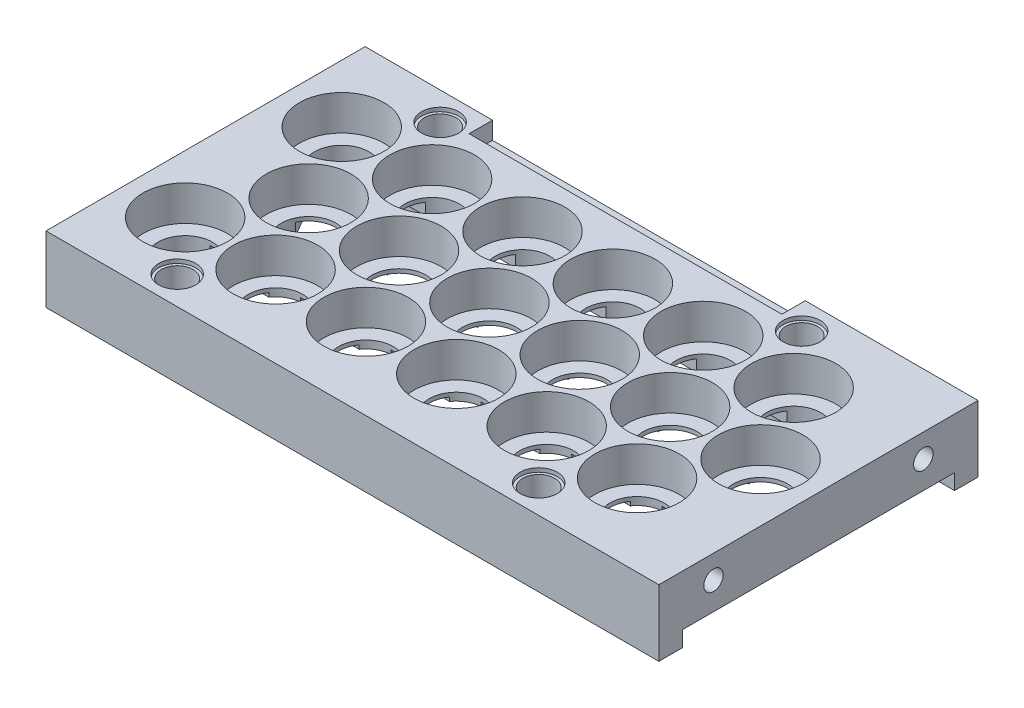
from build123d import *
from build123d.topology import SkipClean

# Parameters (mm, degrees)
SKETCH1_W            = 156.975
SKETCH1_H            = 81.746976195
SKETCH1_R            = 10.825
BOSS_EXTRUDE2_DEPTH  = 11
SKETCH1_3_R          = 10.825
SKETCH1_3_R_2        = 7
BOSS_EXTRUDE3_DEPTH  = 2
CUT_EXTRUDE1_DEPTH   = 1
CUT_EXTRUDE3_REACH   = 157.046
SKETCH9_R            = 4.0767
SKETCH10_R           = 4.7625
CUT_EXTRUDE4_DEPTH   = 1
SKETCH13_R           = 6.5
BOSS_EXTRUDE7_DEPTH  = 6
BOSS_EXTRUDE9_START  = 2
BOSS_EXTRUDE9_DEPTH  = 2
BOSS_EXTRUDE10_DEPTH = 2
SKETCH17_R           = 2
CUT_EXTRUDE5_DEPTH   = 4
SKETCH18_W           = 80.1
SKETCH18_H           = 4.475
CUT_EXTRUDE6_DEPTH   = 6
SKETCH19_R           = 2
CUT_EXTRUDE7_DEPTH   = 5
SKETCH20_R           = 2.5
CUT_EXTRUDE8_DEPTH   = 10


with BuildPart() as part:
    # Sketch1 → Boss-Extrude2 (new body)
    with BuildSketch(Plane(origin=(0, 0, 0), x_dir=(1, 0, 0), z_dir=(0, 1, 0))):
        with Locations((63.6625, -20.048488098)):
            Rectangle(SKETCH1_W, SKETCH1_H)
        with Locations((0, -40.096976195)):
            Circle(SKETCH1_R, mode=Mode.SUBTRACT)
        with Locations((23.15, -40.096976195)):
            Circle(SKETCH1_R, mode=Mode.SUBTRACT)
        with Locations((46.3, -40.096976195)):
            Circle(SKETCH1_R, mode=Mode.SUBTRACT)
        with Locations((69.45, -40.096976195)):
            Circle(SKETCH1_R, mode=Mode.SUBTRACT)
        with Locations((92.6, -40.096976195)):
            Circle(SKETCH1_R, mode=Mode.SUBTRACT)
        with Locations((115.75, -40.096976195)):
            Circle(SKETCH1_R, mode=Mode.SUBTRACT)
        with Locations((11.575, -20.048488098)):
            Circle(SKETCH1_R, mode=Mode.SUBTRACT)
        Circle(SKETCH1_R, mode=Mode.SUBTRACT)
        with Locations((23.15, 0)):
            Circle(SKETCH1_R, mode=Mode.SUBTRACT)
        with Locations((34.725, -20.048488098)):
            Circle(SKETCH1_R, mode=Mode.SUBTRACT)
        with Locations((57.875, -20.048488098)):
            Circle(SKETCH1_R, mode=Mode.SUBTRACT)
        with Locations((46.3, 0)):
            Circle(SKETCH1_R, mode=Mode.SUBTRACT)
        with Locations((81.025, -20.048488098)):
            Circle(SKETCH1_R, mode=Mode.SUBTRACT)
        with Locations((69.45, 0)):
            Circle(SKETCH1_R, mode=Mode.SUBTRACT)
        with Locations((92.6, 0)):
            Circle(SKETCH1_R, mode=Mode.SUBTRACT)
        with Locations((104.175, -20.048488098)):
            Circle(SKETCH1_R, mode=Mode.SUBTRACT)
        with Locations((127.325, -20.048488098)):
            Circle(SKETCH1_R, mode=Mode.SUBTRACT)
        with Locations((115.75, 0)):
            Circle(SKETCH1_R, mode=Mode.SUBTRACT)
    extrude(amount=BOSS_EXTRUDE2_DEPTH)

    # Sketch1<3> → Boss-Extrude3 (add)
    # profile 1 of 18: a face of its own
    with BuildSketch(Plane(origin=(0, 0, 0), x_dir=(1, 0, 0), z_dir=(0, 1, 0))):
        Circle(SKETCH1_3_R)
        Circle(SKETCH1_3_R_2, mode=Mode.SUBTRACT)
    # profile 2 of 18: a face of its own
    with BuildSketch(Plane(origin=(0, 0, 0), x_dir=(1, 0, 0), z_dir=(0, 1, 0))):
        with Locations((11.575, -20.048488098)):
            Circle(SKETCH1_3_R)
        with Locations((11.575, -20.048488098)):
            Circle(SKETCH1_3_R_2, mode=Mode.SUBTRACT)
    # profile 3 of 18: a face of its own
    with BuildSketch(Plane(origin=(0, 0, 0), x_dir=(1, 0, 0), z_dir=(0, 1, 0))):
        with Locations((0, -40.096976195)):
            Circle(SKETCH1_3_R)
        with Locations((0, -40.096976195)):
            Circle(SKETCH1_3_R_2, mode=Mode.SUBTRACT)
    # profile 4 of 18: a face of its own
    with BuildSketch(Plane(origin=(0, 0, 0), x_dir=(1, 0, 0), z_dir=(0, 1, 0))):
        with Locations((23.15, 0)):
            Circle(SKETCH1_3_R)
        with Locations((23.15, 0)):
            Circle(SKETCH1_3_R_2, mode=Mode.SUBTRACT)
    # profile 5 of 18: a face of its own
    with BuildSketch(Plane(origin=(0, 0, 0), x_dir=(1, 0, 0), z_dir=(0, 1, 0))):
        with Locations((34.725, -20.048488098)):
            Circle(SKETCH1_3_R)
        with Locations((34.725, -20.048488098)):
            Circle(SKETCH1_3_R_2, mode=Mode.SUBTRACT)
    # profile 6 of 18: a face of its own
    with BuildSketch(Plane(origin=(0, 0, 0), x_dir=(1, 0, 0), z_dir=(0, 1, 0))):
        with Locations((23.15, -40.096976195)):
            Circle(SKETCH1_3_R)
        with Locations((23.15, -40.096976195)):
            Circle(SKETCH1_3_R_2, mode=Mode.SUBTRACT)
    # profile 7 of 18: a face of its own
    with BuildSketch(Plane(origin=(0, 0, 0), x_dir=(1, 0, 0), z_dir=(0, 1, 0))):
        with Locations((46.3, 0)):
            Circle(SKETCH1_3_R)
        with Locations((46.3, 0)):
            Circle(SKETCH1_3_R_2, mode=Mode.SUBTRACT)
    # profile 8 of 18: a face of its own
    with BuildSketch(Plane(origin=(0, 0, 0), x_dir=(1, 0, 0), z_dir=(0, 1, 0))):
        with Locations((57.875, -20.048488098)):
            Circle(SKETCH1_3_R)
        with Locations((57.875, -20.048488098)):
            Circle(SKETCH1_3_R_2, mode=Mode.SUBTRACT)
    # profile 9 of 18: a face of its own
    with BuildSketch(Plane(origin=(0, 0, 0), x_dir=(1, 0, 0), z_dir=(0, 1, 0))):
        with Locations((46.3, -40.096976195)):
            Circle(SKETCH1_3_R)
        with Locations((46.3, -40.096976195)):
            Circle(SKETCH1_3_R_2, mode=Mode.SUBTRACT)
    # profile 10 of 18: a face of its own
    with BuildSketch(Plane(origin=(0, 0, 0), x_dir=(1, 0, 0), z_dir=(0, 1, 0))):
        with Locations((69.45, 0)):
            Circle(SKETCH1_3_R)
        with Locations((69.45, 0)):
            Circle(SKETCH1_3_R_2, mode=Mode.SUBTRACT)
    # profile 11 of 18: a face of its own
    with BuildSketch(Plane(origin=(0, 0, 0), x_dir=(1, 0, 0), z_dir=(0, 1, 0))):
        with Locations((81.025, -20.048488098)):
            Circle(SKETCH1_3_R)
        with Locations((81.025, -20.048488098)):
            Circle(SKETCH1_3_R_2, mode=Mode.SUBTRACT)
    # profile 12 of 18: a face of its own
    with BuildSketch(Plane(origin=(0, 0, 0), x_dir=(1, 0, 0), z_dir=(0, 1, 0))):
        with Locations((69.45, -40.096976195)):
            Circle(SKETCH1_3_R)
        with Locations((69.45, -40.096976195)):
            Circle(SKETCH1_3_R_2, mode=Mode.SUBTRACT)
    # profile 13 of 18: a face of its own
    with BuildSketch(Plane(origin=(0, 0, 0), x_dir=(1, 0, 0), z_dir=(0, 1, 0))):
        with Locations((92.6, 0)):
            Circle(SKETCH1_3_R)
        with Locations((92.6, 0)):
            Circle(SKETCH1_3_R_2, mode=Mode.SUBTRACT)
    # profile 14 of 18: a face of its own
    with BuildSketch(Plane(origin=(0, 0, 0), x_dir=(1, 0, 0), z_dir=(0, 1, 0))):
        with Locations((104.175, -20.048488098)):
            Circle(SKETCH1_3_R)
        with Locations((104.175, -20.048488098)):
            Circle(SKETCH1_3_R_2, mode=Mode.SUBTRACT)
    # profile 15 of 18: a face of its own
    with BuildSketch(Plane(origin=(0, 0, 0), x_dir=(1, 0, 0), z_dir=(0, 1, 0))):
        with Locations((92.6, -40.096976195)):
            Circle(SKETCH1_3_R)
        with Locations((92.6, -40.096976195)):
            Circle(SKETCH1_3_R_2, mode=Mode.SUBTRACT)
    # profile 16 of 18: a face of its own
    with BuildSketch(Plane(origin=(0, 0, 0), x_dir=(1, 0, 0), z_dir=(0, 1, 0))):
        with Locations((115.75, 0)):
            Circle(SKETCH1_3_R)
        with Locations((115.75, 0)):
            Circle(SKETCH1_3_R_2, mode=Mode.SUBTRACT)
    # profile 17 of 18: a face of its own
    with BuildSketch(Plane(origin=(0, 0, 0), x_dir=(1, 0, 0), z_dir=(0, 1, 0))):
        with Locations((127.325, -20.048488098)):
            Circle(SKETCH1_3_R)
        with Locations((127.325, -20.048488098)):
            Circle(SKETCH1_3_R_2, mode=Mode.SUBTRACT)
    # profile 18 of 18: a face of its own
    with BuildSketch(Plane(origin=(0, 0, 0), x_dir=(1, 0, 0), z_dir=(0, 1, 0))):
        with Locations((115.75, -40.096976195)):
            Circle(SKETCH1_3_R)
        with Locations((115.75, -40.096976195)):
            Circle(SKETCH1_3_R_2, mode=Mode.SUBTRACT)
    extrude(amount=BOSS_EXTRUDE3_DEPTH)

    # Sketch2 → Cut-Extrude1 (cut)
    with BuildSketch(Plane.XZ):
        with BuildLine():
            Line((-0.591820292, 33.12203901), (5.238617062, 23.023425283))
            ThreePointArc((5.238617062, 23.023425283), (8.075, 26.110665924), (12.166820292, 27.023425283))
            Line((12.166820292, 27.023425283), (6.92820323, 36.096976195))
            Line((6.92820323, 36.096976195), (17.405437353, 36.096976195))
            ThreePointArc((17.405437353, 36.096976195), (16.15, 40.096976195), (17.405437353, 44.096976195))
            Line((17.405437353, 44.096976195), (5.744562647, 44.096976195))
            ThreePointArc((5.744562647, 44.096976195), (6.062177826, 36.596976195), (-0.591820292, 33.12203901))
        make_face()
        with BuildLine():
            Line((27.79679677, 24.048488098), (17.319562647, 24.048488098))
            ThreePointArc((17.319562647, 24.048488098), (18.575, 20.048488098), (17.319562647, 16.048488098))
            Line((17.319562647, 16.048488098), (27.79679677, 16.048488098))
            Line((27.79679677, 16.048488098), (22.558179708, 6.974937186))
            ThreePointArc((22.558179708, 6.974937186), (26.124937186, 6.336382938), (28.894562647, 4))
            Line((28.894562647, 4), (6.92820323, 4))
            Line((6.92820323, 4), (12.166820292, 13.073550912))
            ThreePointArc((12.166820292, 13.073550912), (8.075, 13.986310271), (5.238617062, 17.073550912))
            Line((5.238617062, 17.073550912), (-0.591820292, 6.974937186))
            ThreePointArc((-0.591820292, 6.974937186), (2.974937186, 6.336382938), (5.744562647, 4))
            Line((5.744562647, 4), (0, 4))
            ThreePointArc((0, 4), (-4, 0), (0, -4))
            Line((0, -4), (115.75, -4))
            ThreePointArc((115.75, -4), (119.75, 0), (115.75, 4))
            Line((115.75, 4), (99.52820323, 4))
            Line((99.52820323, 4), (104.766820292, 13.073550912))
            ThreePointArc((104.766820292, 13.073550912), (97.175, 20.048488098), (104.766820292, 27.023425283))
            Line((104.766820292, 27.023425283), (99.52820323, 36.096976195))
            Line((99.52820323, 36.096976195), (110.005437353, 36.096976195))
            ThreePointArc((110.005437353, 36.096976195), (108.75, 40.096976195), (110.005437353, 44.096976195))
            Line((110.005437353, 44.096976195), (98.344562647, 44.096976195))
            ThreePointArc((98.344562647, 44.096976195), (98.662177826, 36.596976195), (92.008179708, 33.12203901))
            Line((92.008179708, 33.12203901), (97.24679677, 24.048488098))
            Line((97.24679677, 24.048488098), (86.769562647, 24.048488098))
            ThreePointArc((86.769562647, 24.048488098), (88.025, 20.048488098), (86.769562647, 16.048488098))
            Line((86.769562647, 16.048488098), (97.24679677, 16.048488098))
            Line((97.24679677, 16.048488098), (92.008179708, 6.974937186))
            ThreePointArc((92.008179708, 6.974937186), (95.574937186, 6.336382938), (98.344562647, 4))
            Line((98.344562647, 4), (76.37820323, 4))
            Line((76.37820323, 4), (81.616820292, 13.073550912))
            ThreePointArc((81.616820292, 13.073550912), (74.025, 20.048488098), (81.616820292, 27.023425283))
            Line((81.616820292, 27.023425283), (76.37820323, 36.096976195))
            Line((76.37820323, 36.096976195), (86.855437353, 36.096976195))
            ThreePointArc((86.855437353, 36.096976195), (85.6, 40.096976195), (86.855437353, 44.096976195))
            Line((86.855437353, 44.096976195), (75.194562647, 44.096976195))
            ThreePointArc((75.194562647, 44.096976195), (75.512177826, 36.596976195), (68.858179708, 33.12203901))
            Line((68.858179708, 33.12203901), (74.09679677, 24.048488098))
            Line((74.09679677, 24.048488098), (63.619562647, 24.048488098))
            ThreePointArc((63.619562647, 24.048488098), (64.875, 20.048488098), (63.619562647, 16.048488098))
            Line((63.619562647, 16.048488098), (74.09679677, 16.048488098))
            Line((74.09679677, 16.048488098), (68.858179708, 6.974937186))
            ThreePointArc((68.858179708, 6.974937186), (72.424937186, 6.336382938), (75.194562647, 4))
            Line((75.194562647, 4), (53.22820323, 4))
            Line((53.22820323, 4), (58.466820292, 13.073550912))
            ThreePointArc((58.466820292, 13.073550912), (50.875, 20.048488098), (58.466820292, 27.023425283))
            Line((58.466820292, 27.023425283), (53.22820323, 36.096976195))
            Line((53.22820323, 36.096976195), (63.705437353, 36.096976195))
            ThreePointArc((63.705437353, 36.096976195), (62.45, 40.096976195), (63.705437353, 44.096976195))
            Line((63.705437353, 44.096976195), (52.044562647, 44.096976195))
            ThreePointArc((52.044562647, 44.096976195), (52.362177826, 36.596976195), (45.708179708, 33.12203901))
            Line((45.708179708, 33.12203901), (50.94679677, 24.048488098))
            Line((50.94679677, 24.048488098), (40.469562647, 24.048488098))
            ThreePointArc((40.469562647, 24.048488098), (41.725, 20.048488098), (40.469562647, 16.048488098))
            Line((40.469562647, 16.048488098), (50.94679677, 16.048488098))
            Line((50.94679677, 16.048488098), (45.708179708, 6.974937186))
            ThreePointArc((45.708179708, 6.974937186), (49.274937186, 6.336382938), (52.044562647, 4))
            Line((52.044562647, 4), (30.07820323, 4))
            Line((30.07820323, 4), (35.316820292, 13.073550912))
            ThreePointArc((35.316820292, 13.073550912), (27.725, 20.048488098), (35.316820292, 27.023425283))
            Line((35.316820292, 27.023425283), (30.07820323, 36.096976195))
            Line((30.07820323, 36.096976195), (40.555437353, 36.096976195))
            ThreePointArc((40.555437353, 36.096976195), (39.3, 40.096976195), (40.555437353, 44.096976195))
            Line((40.555437353, 44.096976195), (28.894562647, 44.096976195))
            ThreePointArc((28.894562647, 44.096976195), (29.212177826, 36.596976195), (22.558179708, 33.12203901))
            Line((22.558179708, 33.12203901), (27.79679677, 24.048488098))
        make_face()
        with BuildLine():
            Line((127.916820292, 27.023425283), (122.086382938, 37.12203901))
            ThreePointArc((122.086382938, 37.12203901), (119.25, 34.034798369), (115.158179708, 33.12203901))
            Line((115.158179708, 33.12203901), (120.39679677, 24.048488098))
            Line((120.39679677, 24.048488098), (109.919562647, 24.048488098))
            ThreePointArc((109.919562647, 24.048488098), (111.175, 20.048488098), (109.919562647, 16.048488098))
            Line((109.919562647, 16.048488098), (120.39679677, 16.048488098))
            Line((120.39679677, 16.048488098), (115.158179708, 6.974937186))
            ThreePointArc((115.158179708, 6.974937186), (119.25, 6.062177826), (122.086382938, 2.974937186))
            Line((122.086382938, 2.974937186), (127.916820292, 13.073550912))
            ThreePointArc((127.916820292, 13.073550912), (120.325, 20.048488098), (127.916820292, 27.023425283))
        make_face()
    extrude(amount=-CUT_EXTRUDE1_DEPTH, mode=Mode.SUBTRACT)

    # Sketch9 → Cut-Extrude3 (cut, up to next)
    with BuildSketch(Plane(origin=(0, 11, 0), x_dir=(1, 0, 0), z_dir=(0, 1, 0)), mode=Mode.PRIVATE) as cut_extrude3_sk1:
        with Locations((11.575, 13.625)):
            Circle(SKETCH9_R)
    cut_extrude3_tool1 = extrude(cut_extrude3_sk1.sketch, amount=-CUT_EXTRUDE3_REACH, mode=Mode.PRIVATE) & part.part
    # Sketch9 → Cut-Extrude3 (cut, up to next)
    with BuildSketch(Plane(origin=(0, 11, 0), x_dir=(1, 0, 0), z_dir=(0, 1, 0)), mode=Mode.PRIVATE) as cut_extrude3_sk2:
        with Locations((11.575, -53.721976195)):
            Circle(SKETCH9_R)
    cut_extrude3_tool2 = extrude(cut_extrude3_sk2.sketch, amount=-CUT_EXTRUDE3_REACH, mode=Mode.PRIVATE) & part.part
    # Sketch9 → Cut-Extrude3 (cut, up to next)
    with BuildSketch(Plane(origin=(0, 11, 0), x_dir=(1, 0, 0), z_dir=(0, 1, 0)), mode=Mode.PRIVATE) as cut_extrude3_sk3:
        with Locations((104.175, -53.721976195)):
            Circle(SKETCH9_R)
    cut_extrude3_tool3 = extrude(cut_extrude3_sk3.sketch, amount=-CUT_EXTRUDE3_REACH, mode=Mode.PRIVATE) & part.part
    # Sketch9 → Cut-Extrude3 (cut, up to next)
    with BuildSketch(Plane(origin=(0, 11, 0), x_dir=(1, 0, 0), z_dir=(0, 1, 0)), mode=Mode.PRIVATE) as cut_extrude3_sk4:
        with Locations((104.175, 13.625)):
            Circle(SKETCH9_R)
    cut_extrude3_tool4 = extrude(cut_extrude3_sk4.sketch, amount=-CUT_EXTRUDE3_REACH, mode=Mode.PRIVATE) & part.part
    add(cut_extrude3_tool1.solids().sort_by_distance((11.575, 11, -13.625))[0], mode=Mode.SUBTRACT)
    add(cut_extrude3_tool2.solids().sort_by_distance((11.575, 11, 53.721976))[0], mode=Mode.SUBTRACT)
    add(cut_extrude3_tool3.solids().sort_by_distance((104.175, 11, 53.721976))[0], mode=Mode.SUBTRACT)
    add(cut_extrude3_tool4.solids().sort_by_distance((104.175, 11, -13.625))[0], mode=Mode.SUBTRACT)

    # Sketch10 → Cut-Extrude4 (cut)
    with BuildSketch(Plane(origin=(0, 11, 0), x_dir=(1, 0, 0), z_dir=(0, 1, 0))):
        with Locations((11.575, 13.625)):
            Circle(SKETCH10_R)
        with Locations((104.175, 13.625)):
            Circle(SKETCH10_R)
        with Locations((104.175, -53.721976195)):
            Circle(SKETCH10_R)
        with Locations((11.575, -53.721976195)):
            Circle(SKETCH10_R)
    extrude(amount=-CUT_EXTRUDE4_DEPTH, mode=Mode.SUBTRACT)

    # Sketch13 → Boss-Extrude7 (add)
    # profile 1 of 2: a face of its own
    with BuildSketch(Plane.XZ):
        with BuildLine():
            ThreePointArc((3.665512027, 54.921976195), (11.575, 45.721976195), (19.484487973, 54.921976195))
            Line((19.484487973, 54.921976195), (96.265512027, 54.921976195))
            ThreePointArc((96.265512027, 54.921976195), (104.175, 45.721976195), (112.084487973, 54.921976195))
            Line((112.084487973, 54.921976195), (142.15, 54.921976195))
            Line((142.15, 54.921976195), (142.15, 60.921976195))
            Line((142.15, 60.921976195), (-14.825, 60.921976195))
            Line((-14.825, 60.921976195), (-14.825, 54.921976195))
            Line((-14.825, 54.921976195), (3.665512027, 54.921976195))
        make_face()
        with Locations((11.575, 53.721976195)):
            Circle(SKETCH13_R, mode=Mode.SUBTRACT)
        with Locations((104.175, 53.721976195)):
            Circle(SKETCH13_R, mode=Mode.SUBTRACT)
    # profile 2 of 2: a face of its own
    with BuildSketch(Plane.XZ):
        with BuildLine():
            Line((-14.825, -14.825), (-14.825, -20.825))
            Line((-14.825, -20.825), (142.15, -20.825))
            Line((142.15, -20.825), (142.15, -14.825))
            Line((142.15, -14.825), (112.084487973, -14.825))
            ThreePointArc((112.084487973, -14.825), (104.175, -5.625), (96.265512027, -14.825))
            Line((96.265512027, -14.825), (19.484487973, -14.825))
            ThreePointArc((19.484487973, -14.825), (11.575, -5.625), (3.665512027, -14.825))
            Line((3.665512027, -14.825), (-14.825, -14.825))
        make_face()
        with Locations((11.575, -13.625)):
            Circle(SKETCH13_R, mode=Mode.SUBTRACT)
        with Locations((104.175, -13.625)):
            Circle(SKETCH13_R, mode=Mode.SUBTRACT)
    extrude(amount=BOSS_EXTRUDE7_DEPTH)

    # Sketch14 → Boss-Extrude9 (add)
    with SkipClean():  # the faces are left unmerged after this step: merging them gives an invalid solid
        with BuildSketch(Plane.XZ.offset(BOSS_EXTRUDE9_START)):
            with BuildLine():
                Line((142.15, 54.921976195), (142.15, -14.825))
                Line((142.15, -14.825), (112.084487973, -14.825))
                ThreePointArc((112.084487973, -14.825), (104.175, -5.625), (96.265512027, -14.825))
                Line((96.265512027, -14.825), (19.484487973, -14.825))
                ThreePointArc((19.484487973, -14.825), (11.575, -5.625), (3.665512027, -14.825))
                Line((3.665512027, -14.825), (-14.825, -14.825))
                Line((-14.825, -14.825), (-14.825, 54.921976195))
                Line((-14.825, 54.921976195), (3.665512027, 54.921976195))
                ThreePointArc((3.665512027, 54.921976195), (11.575, 45.721976195), (19.484487973, 54.921976195))
                Line((19.484487973, 54.921976195), (96.265512027, 54.921976195))
                ThreePointArc((96.265512027, 54.921976195), (104.175, 45.721976195), (112.084487973, 54.921976195))
                Line((112.084487973, 54.921976195), (142.15, 54.921976195))
            make_face()
            with BuildLine():
                Line((5.238617062, 17.073550912), (-0.591820292, 6.974937186))
                ThreePointArc((-0.591820292, 6.974937186), (-6.062177826, -3.5), (5.744562647, -4))
                Line((5.744562647, -4), (17.405437353, -4))
                ThreePointArc((17.405437353, -4), (23.15, -7), (28.894562647, -4))
                Line((28.894562647, -4), (40.555437353, -4))
                ThreePointArc((40.555437353, -4), (46.3, -7), (52.044562647, -4))
                Line((52.044562647, -4), (63.705437353, -4))
                ThreePointArc((63.705437353, -4), (69.45, -7), (75.194562647, -4))
                Line((75.194562647, -4), (86.855437353, -4))
                ThreePointArc((86.855437353, -4), (92.6, -7), (98.344562647, -4))
                Line((98.344562647, -4), (110.005437353, -4))
                ThreePointArc((110.005437353, -4), (119.25, -6.062177826), (122.086382938, 2.974937186))
                Line((122.086382938, 2.974937186), (127.916820292, 13.073550912))
                ThreePointArc((127.916820292, 13.073550912), (134.325, 20.048488098), (127.916820292, 27.023425283))
                Line((127.916820292, 27.023425283), (122.086382938, 37.12203901))
                ThreePointArc((122.086382938, 37.12203901), (119.25, 46.159154022), (110.005437353, 44.096976195))
                Line((110.005437353, 44.096976195), (98.344562647, 44.096976195))
                ThreePointArc((98.344562647, 44.096976195), (92.6, 47.096976195), (86.855437353, 44.096976195))
                Line((86.855437353, 44.096976195), (75.194562647, 44.096976195))
                ThreePointArc((75.194562647, 44.096976195), (69.45, 47.096976195), (63.705437353, 44.096976195))
                Line((63.705437353, 44.096976195), (52.044562647, 44.096976195))
                ThreePointArc((52.044562647, 44.096976195), (46.3, 47.096976195), (40.555437353, 44.096976195))
                Line((40.555437353, 44.096976195), (28.894562647, 44.096976195))
                ThreePointArc((28.894562647, 44.096976195), (23.15, 47.096976195), (17.405437353, 44.096976195))
                Line((17.405437353, 44.096976195), (5.744562647, 44.096976195))
                ThreePointArc((5.744562647, 44.096976195), (-6.062177826, 43.596976195), (-0.591820292, 33.12203901))
                Line((-0.591820292, 33.12203901), (5.238617062, 23.023425283))
                ThreePointArc((5.238617062, 23.023425283), (4.575, 20.048488098), (5.238617062, 17.073550912))
            make_face(mode=Mode.SUBTRACT)
        extrude(amount=-BOSS_EXTRUDE9_DEPTH)

    # Sketch16 → Boss-Extrude10 (add)
    with SkipClean():  # the faces are left unmerged after this step: merging them gives an invalid solid
        with BuildSketch(Plane.XZ):
            with BuildLine():
                Line((15.536128823, 32.859238845), (20.688871177, 29.884301659))
                ThreePointArc((20.688871177, 29.884301659), (21.237909283, 27.835263554), (19.188871177, 27.286225448))
                Line((19.188871177, 27.286225448), (14.036128823, 30.261162634))
                ThreePointArc((14.036128823, 30.261162634), (13.487090717, 32.310200739), (15.536128823, 32.859238845))
            make_face()
            with BuildLine():
                Line((38.686128823, 32.859238845), (43.838871177, 29.884301659))
                ThreePointArc((43.838871177, 29.884301659), (44.387909283, 27.835263554), (42.338871177, 27.286225448))
                Line((42.338871177, 27.286225448), (37.186128823, 30.261162634))
                ThreePointArc((37.186128823, 30.261162634), (36.637090717, 32.310200739), (38.686128823, 32.859238845))
            make_face()
            with BuildLine():
                Line((61.836128823, 32.859238845), (66.988871177, 29.884301659))
                ThreePointArc((66.988871177, 29.884301659), (67.537909283, 27.835263554), (65.488871177, 27.286225448))
                Line((65.488871177, 27.286225448), (60.336128823, 30.261162634))
                ThreePointArc((60.336128823, 30.261162634), (59.787090717, 32.310200739), (61.836128823, 32.859238845))
            make_face()
            with BuildLine():
                Line((84.986128823, 32.859238845), (90.138871177, 29.884301659))
                ThreePointArc((90.138871177, 29.884301659), (90.687909283, 27.835263554), (88.638871177, 27.286225448))
                Line((88.638871177, 27.286225448), (83.486128823, 30.261162634))
                ThreePointArc((83.486128823, 30.261162634), (82.937090717, 32.310200739), (84.986128823, 32.859238845))
            make_face()
            with BuildLine():
                Line((108.136128823, 32.859238845), (113.288871177, 29.884301659))
                ThreePointArc((113.288871177, 29.884301659), (113.837909283, 27.835263554), (111.788871177, 27.286225448))
                Line((111.788871177, 27.286225448), (106.636128823, 30.261162634))
                ThreePointArc((106.636128823, 30.261162634), (106.087090717, 32.310200739), (108.136128823, 32.859238845))
            make_face()
            with BuildLine():
                Line((15.536128823, 7.23773735), (20.688871177, 10.212674536))
                ThreePointArc((20.688871177, 10.212674536), (21.237909283, 12.261712642), (19.188871177, 12.810750747))
                Line((19.188871177, 12.810750747), (14.036128823, 9.835813562))
                ThreePointArc((14.036128823, 9.835813562), (13.487090717, 7.786775456), (15.536128823, 7.23773735))
            make_face()
            with BuildLine():
                Line((38.686128823, 7.23773735), (43.838871177, 10.212674536))
                ThreePointArc((43.838871177, 10.212674536), (44.387909283, 12.261712642), (42.338871177, 12.810750747))
                Line((42.338871177, 12.810750747), (37.186128823, 9.835813562))
                ThreePointArc((37.186128823, 9.835813562), (36.637090717, 7.786775456), (38.686128823, 7.23773735))
            make_face()
            with BuildLine():
                Line((61.836128823, 7.23773735), (66.988871177, 10.212674536))
                ThreePointArc((66.988871177, 10.212674536), (67.537909283, 12.261712642), (65.488871177, 12.810750747))
                Line((65.488871177, 12.810750747), (60.336128823, 9.835813562))
                ThreePointArc((60.336128823, 9.835813562), (59.787090717, 7.786775456), (61.836128823, 7.23773735))
            make_face()
            with BuildLine():
                Line((84.986128823, 7.23773735), (90.138871177, 10.212674536))
                ThreePointArc((90.138871177, 10.212674536), (90.687909283, 12.261712642), (88.638871177, 12.810750747))
                Line((88.638871177, 12.810750747), (83.486128823, 9.835813562))
                ThreePointArc((83.486128823, 9.835813562), (82.937090717, 7.786775456), (84.986128823, 7.23773735))
            make_face()
            with BuildLine():
                Line((108.136128823, 7.23773735), (113.288871177, 10.212674536))
                ThreePointArc((113.288871177, 10.212674536), (113.837909283, 12.261712642), (111.788871177, 12.810750747))
                Line((111.788871177, 12.810750747), (106.636128823, 9.835813562))
                ThreePointArc((106.636128823, 9.835813562), (106.087090717, 7.786775456), (108.136128823, 7.23773735))
            make_face()
        extrude(amount=BOSS_EXTRUDE10_DEPTH)

    # Sketch17 → Cut-Extrude5 (cut)
    with BuildSketch(Plane(origin=(0, -2, 0), x_dir=(-1, 0, 0), z_dir=(0, -1, 0))):
        with Locations((10.825, -49.509476195)):
            Circle(SKETCH17_R)
        with Locations((-57.875, -49.509476195)):
            Circle(SKETCH17_R)
        with Locations((-132.15, -49.509476195)):
            Circle(SKETCH17_R)
        with Locations((-132.15, 9.4125)):
            Circle(SKETCH17_R)
        with Locations((-57.875, 9.4125)):
            Circle(SKETCH17_R)
        with Locations((10.825, 9.4125)):
            Circle(SKETCH17_R)
    extrude(amount=-CUT_EXTRUDE5_DEPTH, mode=Mode.SUBTRACT)

    # Sketch18 → Cut-Extrude6 (cut)
    with BuildSketch(Plane(origin=(0, 0, -20.825), x_dir=(-1, 0, 0), z_dir=(0, 0, -1))):
        with Locations((-57.85, 8.7625)):
            Rectangle(SKETCH18_W, SKETCH18_H)
    extrude(amount=-CUT_EXTRUDE6_DEPTH, mode=Mode.SUBTRACT)

    # Sketch19 → Cut-Extrude7 (cut)
    with BuildSketch(Plane(origin=(0, 0, -20.825), x_dir=(-1, 0, 0), z_dir=(0, 0, -1))):
        with Locations((-85.9, 0.2625)):
            Circle(SKETCH19_R)
        with Locations((-29.8, 0.2625)):
            Circle(SKETCH19_R)
    extrude(amount=-CUT_EXTRUDE7_DEPTH, mode=Mode.SUBTRACT)

    # Sketch20 → Cut-Extrude8 (cut)
    with BuildSketch(Plane(origin=(142.15, 0, 0), x_dir=(0, 0, -1), z_dir=(1, 0, 0))):
        with Locations((-46.921976195, 5)):
            Circle(SKETCH20_R)
        with Locations((6.825, 5)):
            Circle(SKETCH20_R)
    extrude(amount=-CUT_EXTRUDE8_DEPTH, mode=Mode.SUBTRACT)


solid = part.part
